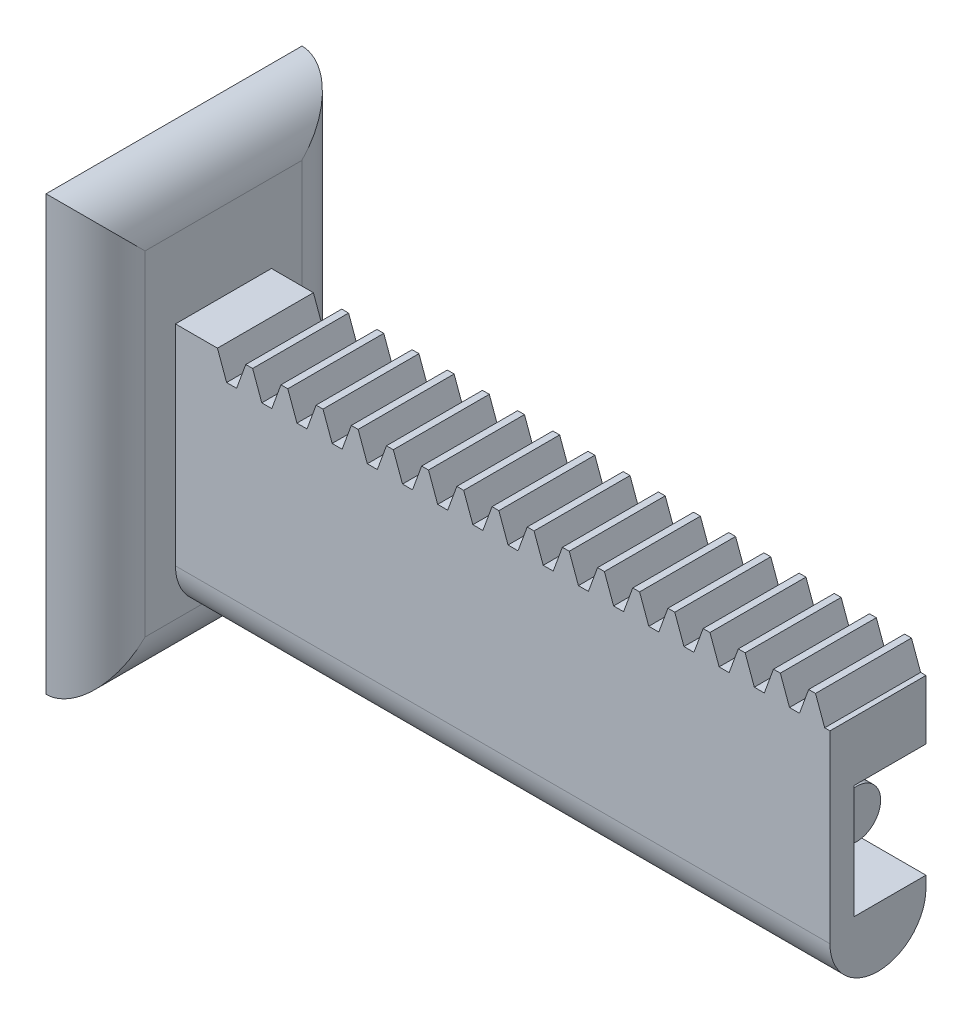
from build123d import *

# Parameters (mm, degrees)
BLANKSKE_W               = 44
BLANKSKE_H               = 16.7
BLANK_DEPTH              = 4
TOOTHCUTSIM_DEPTH        = 48.232298271
TEETHCUTS_COUNT          = 21
TEETHCUTS_PITCH          = 2.199114855
CROQUIS2_W               = 44
CROQUIS2_H               = 4
CORTAR_EXTRUIR2_DEPTH    = 0.6
CROQUIS3_W               = 2.5
CROQUIS3_H               = 7.1
CORTAR_EXTRUIR3_DEPTH    = 37
CROQUIS4_W               = 5.711786687
CROQUIS4_H               = 1.575
SALIENTE_EXTRUIR4_DEPTH  = 4
CROQUIS5_W               = 1.12
CROQUIS5_H               = 4.3
SALIENTE_EXTRUIR5_DEPTH  = 4.2
CROQUIS14_R              = 1.5
SALIENTE_EXTRUIR11_DEPTH = 2.5
CROQUIS15_W              = 3.088906297
CROQUIS15_H              = 16.1
SALIENTE_EXTRUIR12_DEPTH = 5
CROQUIS16_W              = 2.855893344
CROQUIS16_H              = 16.1
SALIENTE_EXTRUIR13_DEPTH = 5
SALIENTE_EXTRUIR14_DEPTH = 2
CROQUIS18_W              = 4.2
CROQUIS18_H              = 4.3
SALIENTE_EXTRUIR15_DEPTH = 2
CROQUIS19_W              = 2.855893344
CROQUIS19_H              = 14
SALIENTE_EXTRUIR16_DEPTH = 8
CROQUIS20_W              = 2.855893344
CROQUIS20_H              = 24.1
SALIENTE_EXTRUIR18_DEPTH = 2
SALIENTE_EXTRUIR19_DEPTH = 3
CROQUIS31_W              = 2.855893344
CROQUIS31_H              = 27.1
SALIENTE_EXTRUIR20_DEPTH = 16
CROQUIS32_W              = 3.088906297
CROQUIS32_H              = 27.1
SALIENTE_EXTRUIR21_DEPTH = 16
REDONDEO3_R              = 3
REDONDEO4_R              = 3.1


# Some blends are built 0.0001 mm under size
with BuildPart() as part:
    # BlankSke → Blank (new body)
    with BuildSketch(Plane.XY):
        with Locations((22, 8.35)):
            Rectangle(BLANKSKE_W, BLANKSKE_H)
    extrude(amount=-BLANK_DEPTH)

    # TooCutSkeSim → ToothCutSim (cut, through all)
    with BuildSketch(Plane.XY):
        Polygon((0.312304759, 15.125), (-0.312304759, 15.125), (-0.894802722, 16.7254), (0.894802722, 16.7254), align=None)
    toothcutsim = extrude(amount=-TOOTHCUTSIM_DEPTH, mode=Mode.SUBTRACT)

    # TeethCuts: ToothCutSim ×21
    with Locations(*[(i * TEETHCUTS_PITCH, 0, 0) for i in range(1, TEETHCUTS_COUNT)]):
        add(toothcutsim, mode=Mode.SUBTRACT)

    # Croquis2 → Cortar-Extruir2 (cut)
    with BuildSketch(Plane.XZ):
        with Locations((22, -2)):
            Rectangle(CROQUIS2_W, CROQUIS2_H)
    extrude(amount=-CORTAR_EXTRUIR2_DEPTH, mode=Mode.SUBTRACT)

    # Croquis3 → Cortar-Extruir3 (cut)
    with BuildSketch(Plane(origin=(44, 0, 0), x_dir=(0, 0, -1), z_dir=(1, 0, 0))):
        with Locations((2.75, 7.8625)):
            Rectangle(CROQUIS3_W, CROQUIS3_H)
    extrude(amount=-CORTAR_EXTRUIR3_DEPTH, mode=Mode.SUBTRACT)

    # Croquis4 → Saliente-Extruir4 (add)
    with BuildSketch(Plane.XY):
        with Locations((2.855893344, 15.9125)):
            Rectangle(CROQUIS4_W, CROQUIS4_H)
    extrude(amount=-SALIENTE_EXTRUIR4_DEPTH)

    # Croquis5 → Saliente-Extruir5 (add)
    with BuildSketch(Plane(origin=(0, 0, -1.5), x_dir=(-1, 0, 0), z_dir=(0, 0, -1))):
        with Locations((-39.01, 7.8625)):
            Rectangle(CROQUIS5_W, CROQUIS5_H)
    extrude(amount=SALIENTE_EXTRUIR5_DEPTH)

    # Croquis14 → Saliente-Extruir11 (add)
    with BuildSketch(Plane(origin=(39.57, 0, 0), x_dir=(0, 0, -1), z_dir=(1, 0, 0))):
        with Locations(Location((3.6, 7.8625, 0), (0, 0, 180))):
            Circle(CROQUIS14_R)
    extrude(amount=SALIENTE_EXTRUIR11_DEPTH)

    # Croquis15 → Saliente-Extruir12 (add)
    with BuildSketch(Plane.XY):
        with Locations((1.544453149, 8.65)):
            Rectangle(CROQUIS15_W, CROQUIS15_H)
    extrude(amount=SALIENTE_EXTRUIR12_DEPTH)

    # Croquis16 → Saliente-Extruir13 (add)
    with BuildSketch(Plane(origin=(0, 0, -4), x_dir=(-1, 0, 0), z_dir=(0, 0, -1))):
        with Locations((-1.427946672, 8.65)):
            Rectangle(CROQUIS16_W, CROQUIS16_H)
    extrude(amount=SALIENTE_EXTRUIR13_DEPTH)

    # Croquis17 → Saliente-Extruir14 (add)
    with BuildSketch(Plane(origin=(0, 0, -4), x_dir=(-1, 0, 0), z_dir=(0, 0, -1))):
        Polygon((-44, 0.6), (-2.855893344, 0.6), (-2.855893344, 16.7), (-5.711786687, 16.7), (-6.285039806, 15.125), (-6.909649324, 15.125), (-7.482902443, 16.7), (-7.910901542, 16.7), (-8.484154661, 15.125), (-9.108764179, 15.125), (-9.682017298, 16.7), (-10.110016397, 16.7), (-10.683269516, 15.125), (-11.307879034, 15.125), (-11.881132153, 16.7), (-12.309131252, 16.7), (-12.882384371, 15.125), (-13.506993889, 15.125), (-14.080247008, 16.7), (-14.508246107, 16.7), (-15.081499226, 15.125), (-15.706108744, 15.125), (-16.279361863, 16.7), (-16.707360962, 16.7), (-17.280614081, 15.125), (-17.905223599, 15.125), (-18.478476718, 16.7), (-18.906475817, 16.7), (-19.479728936, 15.125), (-20.104338454, 15.125), (-20.677591573, 16.7), (-21.105590672, 16.7), (-21.678843791, 15.125), (-22.303453309, 15.125), (-22.876706428, 16.7), (-23.304705527, 16.7), (-23.877958646, 15.125), (-24.502568164, 15.125), (-25.075821283, 16.7), (-25.503820382, 16.7), (-26.077073501, 15.125), (-26.701683019, 15.125), (-27.274936138, 16.7), (-27.702935237, 16.7), (-28.276188356, 15.125), (-28.900797874, 15.125), (-29.474050993, 16.7), (-29.902050092, 16.7), (-30.475303211, 15.125), (-31.099912729, 15.125), (-31.673165848, 16.7), (-32.101164947, 16.7), (-32.674418066, 15.125), (-33.299027584, 15.125), (-33.872280703, 16.7), (-34.300279802, 16.7), (-34.873532921, 15.125), (-35.498142439, 15.125), (-36.071395558, 16.7), (-36.499394657, 16.7), (-37.072647776, 15.125), (-37.697257294, 15.125), (-38.270510413, 16.7), (-38.698509512, 16.7), (-39.271762631, 15.125), (-39.896372149, 15.125), (-40.469625268, 16.7), (-40.897624367, 16.7), (-41.470877486, 15.125), (-42.095487004, 15.125), (-42.668740123, 16.7), (-43.096739222, 16.7), (-43.669992341, 15.125), (-44, 15.125), (-44, 11.4125), (-7, 11.4125), (-7, 4.3125), (-44, 4.3125), align=None)
    extrude(amount=SALIENTE_EXTRUIR14_DEPTH)

    # Croquis18 → Saliente-Extruir15 (add)
    with BuildSketch(Plane.ZY.offset(-38.45)):
        with Locations((-3.6, 7.8625)):
            Rectangle(CROQUIS18_W, CROQUIS18_H)
    extrude(amount=SALIENTE_EXTRUIR15_DEPTH)

    # Croquis19 → Saliente-Extruir16 (add)
    with BuildSketch(Plane(origin=(0, 16.7, 0), x_dir=(1, 0, 0), z_dir=(0, 1, 0))):
        with Locations((1.427946672, 2)):
            Rectangle(CROQUIS19_W, CROQUIS19_H)
    extrude(amount=SALIENTE_EXTRUIR16_DEPTH)

    # Croquis20 → Saliente-Extruir18 (add)
    with BuildSketch(Plane(origin=(0, 0, -9), x_dir=(-1, 0, 0), z_dir=(0, 0, -1))):
        with Locations((-1.427946672, 12.65)):
            Rectangle(CROQUIS20_W, CROQUIS20_H)
    extrude(amount=SALIENTE_EXTRUIR18_DEPTH)

    # Croquis21 → Saliente-Extruir19 (add)
    with BuildSketch(Plane.XZ.offset(-0.6)):
        Polygon((3.088906297, 0), (2.855893344, -6), (2.855893344, -11), (0, -11), (0, 5), (3.088906297, 5), align=None)
    extrude(amount=SALIENTE_EXTRUIR19_DEPTH)

    # Croquis31 → Saliente-Extruir20 (add)
    with BuildSketch(Plane(origin=(0, 0, -11), x_dir=(-1, 0, 0), z_dir=(0, 0, -1))):
        with Locations((-1.427946672, 11.15)):
            Rectangle(CROQUIS31_W, CROQUIS31_H)
    extrude(amount=-SALIENTE_EXTRUIR20_DEPTH)

    # Croquis32 → Saliente-Extruir21 (add)
    with BuildSketch(Plane.XY.offset(5)):
        with Locations((1.544453149, 11.15)):
            Rectangle(CROQUIS32_W, CROQUIS32_H)
    extrude(amount=-SALIENTE_EXTRUIR21_DEPTH)

    # Redondeo3
    redondeo3_edges = [part.edges().sort_by_distance(p)[0] for p in [
        (23.544453148, 0.6, -6),
        (23.544453148, 0.6, 0),
    ]]
    fillet(redondeo3_edges, radius=REDONDEO3_R - 0.0001)  # a hair under: the kernel refuses the full size

    # Redondeo4
    # the kernel refuses this fillet: 3.1 mm, written as the material it takes off along each edge
    with BuildSketch(Plane(origin=(3.088906297, -2.4, -18.75), x_dir=(0, 1, 0), z_dir=(0, 0, 1))) as redondeo4_piece_1_section:
        with BuildLine():
            CenterArc((REDONDEO4_R, REDONDEO4_R), REDONDEO4_R, 180, 90)
            Line((0, REDONDEO4_R), (0, 0))
            Line((0, 0), (REDONDEO4_R, 0))
        make_face()
    redondeo4_piece_1 = extrude(amount=31.5, mode=Mode.PRIVATE)
    redondeo4_piece_1 = redondeo4_piece_1 - Plane(origin=(2.386115021, 3.5999, -3.0001), x_dir=(0, -1, 0), z_dir=(-1, 0, 0)) * Cylinder(2.9999, 76, mode=Mode.PRIVATE)
    add(redondeo4_piece_1, mode=Mode.SUBTRACT)
    with BuildSketch(Plane(origin=(3.088906297, -10.15, 5), x_dir=(0, 0, -1), z_dir=(0, 1, 0)), Plane(origin=(3.088906297, 32.45, -11), x_dir=(0, 0, 1), z_dir=(0, -1, 0))) as redondeo4_piece_2:
        with BuildLine():
            CenterArc((REDONDEO4_R, REDONDEO4_R), REDONDEO4_R, 180, 90)
            Line((0, REDONDEO4_R), (0, 0))
            Line((0, 0), (REDONDEO4_R, 0))
        make_face()
    extrude(amount=42.6, mode=Mode.SUBTRACT)
    with BuildSketch(Plane(origin=(3.088906297, 24.7, 12.75), x_dir=(0, -1, 0), z_dir=(0, 0, -1))) as redondeo4_piece_3:
        with BuildLine():
            CenterArc((REDONDEO4_R, REDONDEO4_R), REDONDEO4_R, 180, 90)
            Line((0, REDONDEO4_R), (0, 0))
            Line((0, 0), (REDONDEO4_R, 0))
        make_face()
    extrude(amount=31.5, mode=Mode.SUBTRACT)


solid = part.part
